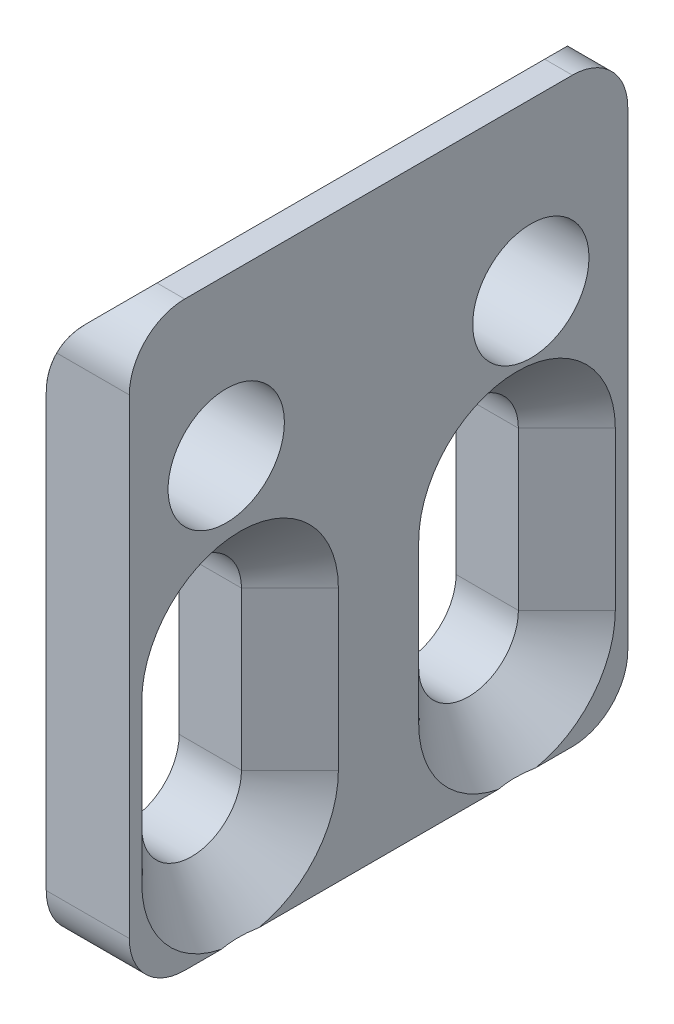
from build123d import *

# Parameters (mm, degrees)
SKETCH1_W           = 18
SKETCH1_H           = 21
SKETCH1_R           = 2.1
BOSS_EXTRUDE1_DEPTH = 4
CUT_EXTRUDE1_DEPTH  = 4
CHAMFER1_SIZE       = 1.75
FILLET1_R           = 2
CHAMFER2_SIZE       = 3
CHAMFER3_SIZE       = 1
FILLET2_R           = 2


with BuildPart() as part:
    # Sketch1 → Boss-Extrude1 (new body)
    with BuildSketch(Plane(origin=(0, 0, 0), x_dir=(0, 0, -1), z_dir=(1, 0, 0))):
        Rectangle(SKETCH1_W, SKETCH1_H)
        with Locations((5.5, 4.5)):
            Circle(SKETCH1_R, mode=Mode.SUBTRACT)
        with Locations((-5.5, 4.846153846)):
            Circle(SKETCH1_R, mode=Mode.SUBTRACT)
    extrude(amount=BOSS_EXTRUDE1_DEPTH)

    # Sketch2 → Cut-Extrude1 (cut)
    with BuildSketch(Plane(origin=(4, 0, 0), x_dir=(0, 0, -1), z_dir=(1, 0, 0))):
        with BuildLine():
            Line((6.8, -1.316455335), (6.8, -7.014826284))
            ThreePointArc((6.8, -7.014826284), (5, -8.814826284), (3.2, -7.014826284))
            Line((3.2, -7.014826284), (3.2, -1.316455335))
            ThreePointArc((3.2, -1.316455335), (5, 0.483544665), (6.8, -1.316455335))
        make_face()
        with BuildLine():
            Line((-3.2, -1.316455335), (-3.2, -7.014826284))
            ThreePointArc((-3.2, -7.014826284), (-5, -8.814826284), (-6.8, -7.014826284))
            Line((-6.8, -7.014826284), (-6.8, -1.316455335))
            ThreePointArc((-6.8, -1.316455335), (-5, 0.483544665), (-3.2, -1.316455335))
        make_face()
    extrude(amount=-CUT_EXTRUDE1_DEPTH, mode=Mode.SUBTRACT)

    # Chamfer1
    # the kernel refuses this chamfer: 1.75 mm, written as the material it takes off along each edge
    with BuildSketch(Plane(origin=(4, -1.316455335, -5), x_dir=(0, 0, 1), z_dir=(0, -1, 0))) as chamfer1_piece_1:
        Polygon((1.8 + CHAMFER1_SIZE, 0), (1.8, CHAMFER1_SIZE), (1.8, 0), align=None)
    revolve(axis=Axis((4, -1.316455335, -5), (-1, 0, 0)), revolution_arc=180, mode=Mode.SUBTRACT)
    with BuildSketch(Plane(origin=(4, -7.014826284, -3.2), x_dir=(0.02749587661058661, 0, 0.9996219169112968), z_dir=(0, 1, 0)), Plane(origin=(4, -1.316455335, -6.8), x_dir=(0.027495876610586112, 0, -0.9996219169112968), z_dir=(0, -1, 0)), Plane(origin=(4, -7.014826284, 6.8), x_dir=(0.02749587661058662, 0, 0.9996219169112968), z_dir=(0, 1, 0)), Plane(origin=(4, -1.316455335, 3.2), x_dir=(0.02749587661058661, 0, -0.9996219169112968), z_dir=(0, -1, 0))) as chamfer1_piece_2:
        Polygon((CHAMFER1_SIZE * 0.999621916911, -CHAMFER1_SIZE * 0.0274958766106), (-CHAMFER1_SIZE * 0.0274958766106, -CHAMFER1_SIZE * 0.999621916911), (0, 0), align=None)
    extrude(amount=5.698370949, mode=Mode.SUBTRACT)
    with BuildSketch(Plane(origin=(4, -7.014826284, -5), x_dir=(0, 0, -1), z_dir=(0, 1, 0))) as chamfer1_piece_3:
        Polygon((1.8 + CHAMFER1_SIZE, 0), (1.8, CHAMFER1_SIZE), (1.8, 0), align=None)
    revolve(axis=Axis((4, -7.014826284, -5), (-1, 0, 0)), revolution_arc=180, mode=Mode.SUBTRACT)
    with BuildSketch(Plane(origin=(4, -1.316455335, 5), x_dir=(0, 0, 1), z_dir=(0, -1, 0))) as chamfer1_piece_4:
        Polygon((1.8 + CHAMFER1_SIZE, 0), (1.8, CHAMFER1_SIZE), (1.8, 0), align=None)
    revolve(axis=Axis((4, -1.316455335, 5), (-1, 0, 0)), revolution_arc=180, mode=Mode.SUBTRACT)
    with BuildSketch(Plane(origin=(4, -7.014826284, 5), x_dir=(0, 0, -1), z_dir=(0, 1, 0))) as chamfer1_piece_5:
        Polygon((1.8 + CHAMFER1_SIZE, 0), (1.8, CHAMFER1_SIZE), (1.8, 0), align=None)
    revolve(axis=Axis((4, -7.014826284, 5), (-1, 0, 0)), revolution_arc=180, mode=Mode.SUBTRACT)

    # Fillet1
    fillet1_edges = [part.edges().sort_by_distance(p)[0] for p in [
        (2, -10.5, -9),
        (2, -10.5, 9),
        (2, 10.5, 9),
        (2, 10.5, -9),
    ]]
    fillet(fillet1_edges, radius=FILLET1_R)

    # Chamfer2
    # the kernel refuses this chamfer: 3 mm, written as the material it takes off along each edge
    with BuildSketch(Plane(origin=(0, 10.5, 14.715048964), x_dir=(0.9996219169112968, 0.027495876610586202, 0), z_dir=(0, 0, -1))) as chamfer2_piece_1:
        Polygon((CHAMFER2_SIZE * 0.999621916911, CHAMFER2_SIZE * 0.0274958766106), (-CHAMFER2_SIZE * 0.0274958766106, CHAMFER2_SIZE * 0.999621916911), (0, 0), align=None)
    extrude(amount=29.430097928, mode=Mode.SUBTRACT)

    # Chamfer3
    chamfer3_edges = [part.edges().sort_by_distance(p)[0] for p in [
        (0, -0.5, -9),
        (0, -9.914213562, -8.414213562),
        (0, -10.5, 0),
        (0, -9.914213562, 8.414213562),
        (0, -0.5, 9),
    ]]
    chamfer(chamfer3_edges, length=CHAMFER3_SIZE)

    # Fillet2
    fillet2_edges = [part.edges().sort_by_distance(p)[0] for p in [
        (0.5, 8, -8.5),
        (0.5, 8, 8.5),
    ]]
    fillet(fillet2_edges, radius=FILLET2_R)


solid = part.part
